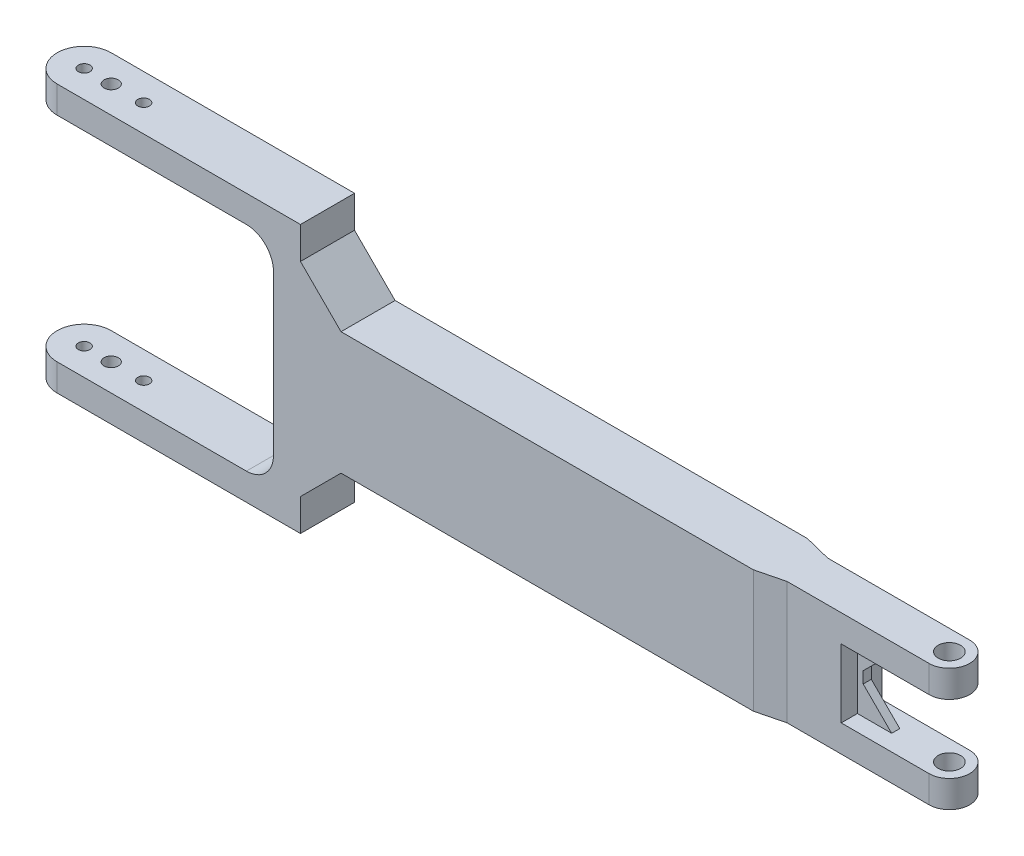
from build123d import *

# Parameters (mm, degrees)
SKETCH_2_W          = 187.5
SKETCH_2_H          = 45.3
EXTRUDE_1_DEPTH     = 10
EXTRUDE_2_DEPTH     = 7.5
CHAMFER_1_SIZE      = 20
CHAMFER_1_SIZE_2    = 5
CHAMFER_2_SIZE      = 5
CHAMFER_2_SIZE_2    = 20
EXTRUDE_3_DEPTH     = 1.5
CHAMFER_3_SIZE      = 3
CUT_EXTRUDE_1_DEPTH = 314.699298692
CUT_EXTRUDE_2_DEPTH = 307.287238552
CHAMFER_4_SIZE      = 15
FILLET_1_R          = 10


with BuildPart() as part:
    # 草图2 → 凸台-拉伸1 (new, symmetric)
    with BuildSketch(Plane.XY):
        with Locations((-103.75, 0)):
            Rectangle(SKETCH_2_W, SKETCH_2_H)
        Polygon((-297.5, 49.5), (-297.5, 39.5), (-207.5, 39.5), (-207.5, -39.5), (-297.5, -39.5), (-297.5, -49.5), (-197.5, -49.5), (-197.5, 49.5), align=None)
    extrude(amount=EXTRUDE_1_DEPTH, both=True)

    # 草图2<3> → 凸台-拉伸2 (add, symmetric)
    with BuildSketch(Plane.XY):
        Polygon((40, -22.65), (40, -12.65), (0, -12.65), (0, 12.65), (40, 12.65), (40, 22.65), (-10, 22.65), (-10, -22.65), align=None)
    extrude(amount=EXTRUDE_2_DEPTH, both=True)

    # 倒角1
    # the kernel refuses this chamfer: 20, 5 mm, written as the material it takes off along each edge
    with BuildSketch(Plane(origin=(-10, -74.592549995, 10), x_dir=(-0.9999563942249224, 0, 0.00933861064031752), z_dir=(0, 1, 0))) as chamfer_1_piece_1_section:
        Polygon((CHAMFER_1_SIZE * 0.999956394225, -CHAMFER_1_SIZE * 0.00933861064032), (-CHAMFER_1_SIZE_2 * 0.00933861064032, -CHAMFER_1_SIZE_2 * 0.999956394225), (0, 0), align=None)
    chamfer_1_piece_1 = extrude(amount=149.185099991, mode=Mode.PRIVATE)
    chamfer_1_piece_1 = split(chamfer_1_piece_1, bisect_by=Plane(origin=(-18.245866107, 0, 7.5), z_dir=(0, 0, 1)), keep=Keep.TOP, mode=Mode.PRIVATE)
    add(chamfer_1_piece_1, mode=Mode.SUBTRACT)

    # 倒角2
    # the kernel refuses this chamfer: 20, 5 mm, written as the material it takes off along each edge
    with BuildSketch(Plane(origin=(-10, -74.592549995, -10), x_dir=(0.14778356633657133, 0, 0.9890197255468893), z_dir=(0, 1, 0))) as chamfer_2_piece_1_section:
        Polygon((CHAMFER_2_SIZE * 0.989019725547, -CHAMFER_2_SIZE * 0.147783566337), (-CHAMFER_2_SIZE_2 * 0.147783566337, -CHAMFER_2_SIZE_2 * 0.989019725547), (0, 0), align=None)
    chamfer_2_piece_1 = extrude(amount=149.185099991, mode=Mode.PRIVATE)
    chamfer_2_piece_1 = split(chamfer_2_piece_1, bisect_by=Plane(origin=(-18.245866107, 0, -7.5), z_dir=(0, 0, -1)), keep=Keep.TOP, mode=Mode.PRIVATE)
    add(chamfer_2_piece_1, mode=Mode.SUBTRACT)

    # 草图2<5> → 凸台-拉伸3 (add, symmetric)
    with BuildSketch(Plane.XY):
        Polygon((12.65, 12.65), (0, 12.65), (0, 0), align=None)
        Polygon((12.65, -12.65), (0, 0), (0, -12.65), align=None)
    extrude(amount=EXTRUDE_3_DEPTH, both=True)

    # 倒角3
    chamfer_3_edges = [part.edges().sort_by_distance(p)[0] for p in [
        (0, 0, 0),
    ]]
    chamfer(chamfer_3_edges, length=CHAMFER_3_SIZE)

    # 草图3 → 切除-拉伸1 (cut, through all)
    with BuildSketch(Plane(origin=(0, 49.5, 0), x_dir=(1, 0, 0), z_dir=(0, 1, 0))):
        with BuildLine():
            ThreePointArc((-297.5, 0), (-294.571067812, 7.071067812), (-287.5, 10))
            Line((-287.5, 10), (-297.5, 10))
            Line((-297.5, 10), (-297.5, 0))
        make_face()
        with BuildLine():
            Line((-297.5, -10), (-287.5, -10))
            ThreePointArc((-287.5, -10), (-294.571067812, -7.071067812), (-297.5, 0))
            Line((-297.5, 0), (-297.5, -10))
        make_face()
        with BuildLine():
            ThreePointArc((-289.65, 0), (-287.5, -2.15), (-285.35, 0))
            Line((-285.35, 0), (-289.65, 0))
        make_face()
        with BuildLine():
            Line((-289.65, 0), (-285.35, 0))
            ThreePointArc((-285.35, 0), (-287.5, 2.15), (-289.65, 0))
        make_face()
        with BuildLine():
            ThreePointArc((-280.15, 0), (-277.5, -2.65), (-274.85, 0))
            Line((-274.85, 0), (-280.15, 0))
        make_face()
        with BuildLine():
            Line((-280.15, 0), (-274.85, 0))
            ThreePointArc((-274.85, 0), (-277.5, 2.65), (-280.15, 0))
        make_face()
        with BuildLine():
            ThreePointArc((-267.65, 0), (-265.5, -2.15), (-263.35, 0))
            Line((-263.35, 0), (-267.65, 0))
        make_face()
        with BuildLine():
            Line((-267.65, 0), (-263.35, 0))
            ThreePointArc((-263.35, 0), (-265.5, 2.15), (-267.65, 0))
        make_face()
    extrude(amount=-CUT_EXTRUDE_1_DEPTH, mode=Mode.SUBTRACT)

    # 草图4 → 切除-拉伸2 (cut, through all)
    with BuildSketch(Plane(origin=(0, 22.65, 0), x_dir=(1, 0, 0), z_dir=(0, 1, 0))):
        with BuildLine():
            ThreePointArc((28.35, 0), (32.5, -4.15), (36.65, 0))
            Line((36.65, 0), (28.35, 0))
        make_face()
        with BuildLine():
            Line((28.35, 0), (36.65, 0))
            ThreePointArc((36.65, 0), (32.5, 4.15), (28.35, 0))
        make_face()
        with BuildLine():
            ThreePointArc((32.5, 7.5), (37.803300859, 5.303300859), (40, 0))
            Line((40, 0), (40, 7.5))
            Line((40, 7.5), (32.5, 7.5))
        make_face()
        with BuildLine():
            Line((40, -7.5), (40, 0))
            ThreePointArc((40, 0), (37.80330088, -5.303300838), (32.500000061, -7.5))
            Line((32.500000061, -7.5), (40, -7.5))
        make_face()
    extrude(amount=-CUT_EXTRUDE_2_DEPTH, mode=Mode.SUBTRACT)

    # 倒角4
    chamfer_4_edges = [part.edges().sort_by_distance(p)[0] for p in [
        (-197.5, -22.65, 0),
        (-197.5, 22.65, 0),
    ]]
    chamfer(chamfer_4_edges, length=CHAMFER_4_SIZE)

    # 圆角1
    fillet_1_edges = [part.edges().sort_by_distance(p)[0] for p in [
        (-207.5, -39.5, 0),
        (-207.5, 39.5, 0),
    ]]
    fillet(fillet_1_edges, radius=FILLET_1_R)


solid = part.part
